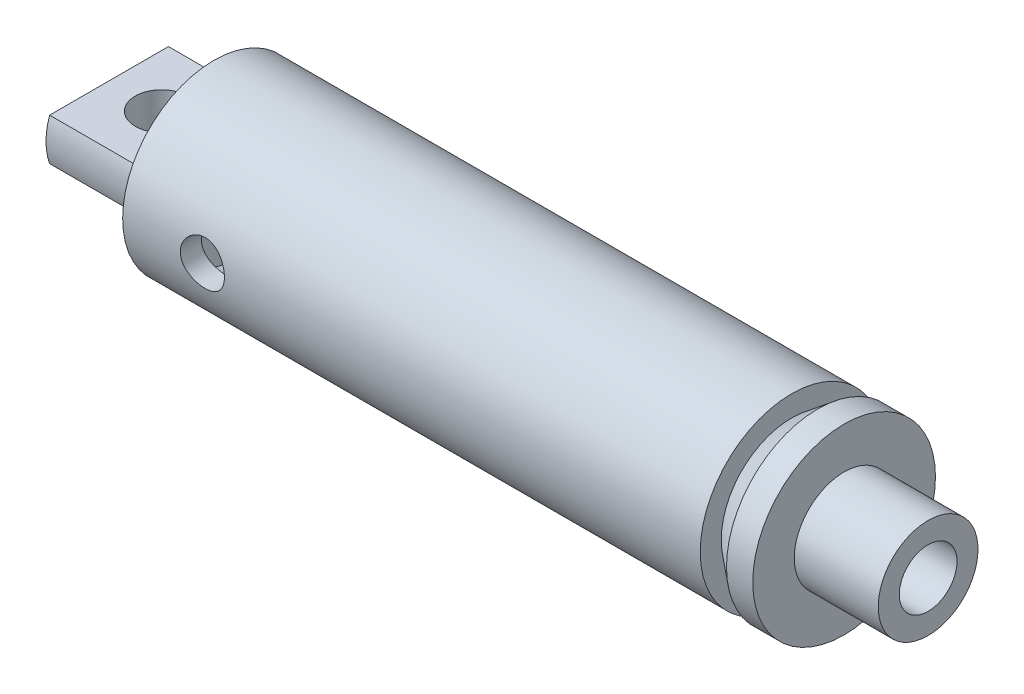
from build123d import *

# Parameters (mm, degrees)
SKETCH_1_R          = 8.7
SKETCH_1_R_2        = 6.7
EXTRUDE_1_DEPTH     = 60
EXTRUDE_START       = -2
SKETCH_2_R          = 8.7
SKETCH_2_R_2        = 2.75
EXTRUDE_1_2_DEPTH   = 2
SKETCH_3_R          = 4.75
SKETCH_3_R_2        = 2.75
EXTRUDE_2_DEPTH     = 8
SKETCH_4_R          = 6.7
EXTRUDE_2_2_DEPTH   = 2
SKETCH_13_W         = 2.1
SKETCH_13_H         = 10
SKETCH_14_R         = 6
EXTRUDE_3_DEPTH     = 10
CUT_EXTRUDE_2_DEPTH = 10
SKETCH_16_R         = 2.5
CUT_EXTRUDE_3_DEPTH = 10


with BuildPart() as part:
    # 草图1 → Extrude 1 (new body)
    with BuildSketch(Plane(origin=(0, 0, 0), x_dir=(0, 0, -1), z_dir=(1, 0, 0))):
        Circle(SKETCH_1_R)
        Circle(SKETCH_1_R_2, mode=Mode.SUBTRACT)
    extrude(amount=EXTRUDE_1_DEPTH)

    # 草图2 → Extrude 1 2 (add)
    with BuildSketch(Plane(origin=(60, 0, 0), x_dir=(0, 0, -1), z_dir=(1, 0, 0)).offset(EXTRUDE_START)):
        Circle(SKETCH_2_R)
        Circle(SKETCH_2_R_2, mode=Mode.SUBTRACT)
    extrude(amount=EXTRUDE_1_2_DEPTH)

    # 草图3 → Extrude 2 (add)
    with BuildSketch(Plane(origin=(60, 0, 0), x_dir=(0, 0, -1), z_dir=(1, 0, 0))):
        Circle(SKETCH_3_R)
        Circle(SKETCH_3_R_2, mode=Mode.SUBTRACT)
    extrude(amount=EXTRUDE_2_DEPTH)

    # 草图4 → Extrude 2 2 (add)
    with BuildSketch(Plane.ZY):
        Circle(SKETCH_4_R)
    extrude(amount=-EXTRUDE_2_2_DEPTH)

    # 草图7 → 切除-旋转1 (revolve, cut)
    with BuildSketch(Plane(origin=(0, 0, 0), x_dir=(1, 0, 0), z_dir=(0, 1, 0))):
        Polygon((57.5, 8.7), (55, 8.7), (55, 6.7), align=None)
    revolve(axis=Axis((-1000, 0, 0), (1, 0, 0)), mode=Mode.SUBTRACT)


with BuildPart() as cut_revolve_1_piece_1:
    # of the separate pieces the step leaves, piece 1, a body of its own (cut_revolve_1_pieces)
    add(part.part.solids().sort_by_distance((55, 0, -8.7))[0])

    # 草图13 → M5 螺纹孔2 (revolve, cut)
    with BuildSketch(Plane(origin=(7.589976154, 0, 10), x_dir=(0, -1, 0), z_dir=(1, 0, 0))):
        with Locations((1.05, 5)):
            Rectangle(SKETCH_13_W, SKETCH_13_H)
    revolve(axis=Axis((7.589976154, 0, 16.35), (0, 0, -1)), mode=Mode.SUBTRACT)

    # 草图14 → 凸台-拉伸3 (add)
    with BuildSketch(Plane.ZY):
        Circle(SKETCH_14_R)
    extrude(amount=EXTRUDE_3_DEPTH)

    # 草图15 → 切除-拉伸2 (cut)
    with BuildSketch(Plane.ZY.offset(10)):
        with BuildLine():
            ThreePointArc((5.656854249, 2), (0, 6), (-5.656854249, 2))
            Line((-5.656854249, 2), (5.656854249, 2))
        make_face()
        with BuildLine():
            Line((5.656854249, -2), (-5.656854249, -2))
            ThreePointArc((-5.656854249, -2), (0, -6), (5.656854249, -2))
        make_face()
    extrude(amount=-CUT_EXTRUDE_2_DEPTH, mode=Mode.SUBTRACT)

    # 草图16 → 切除-拉伸3 (cut)
    with BuildSketch(Plane.XZ.offset(2)):
        with Locations((-5, 0)):
            Circle(SKETCH_16_R)
    extrude(amount=-CUT_EXTRUDE_3_DEPTH, mode=Mode.SUBTRACT)


with BuildPart() as cut_revolve_1_piece_2:
    # of the separate pieces the step leaves, piece 2, a body of its own (cut_revolve_1_pieces)
    add(part.part.solids().sort_by_distance((57.5, 0, -8.7))[0])


solid = Compound([cut_revolve_1_piece_1.part, cut_revolve_1_piece_2.part])
